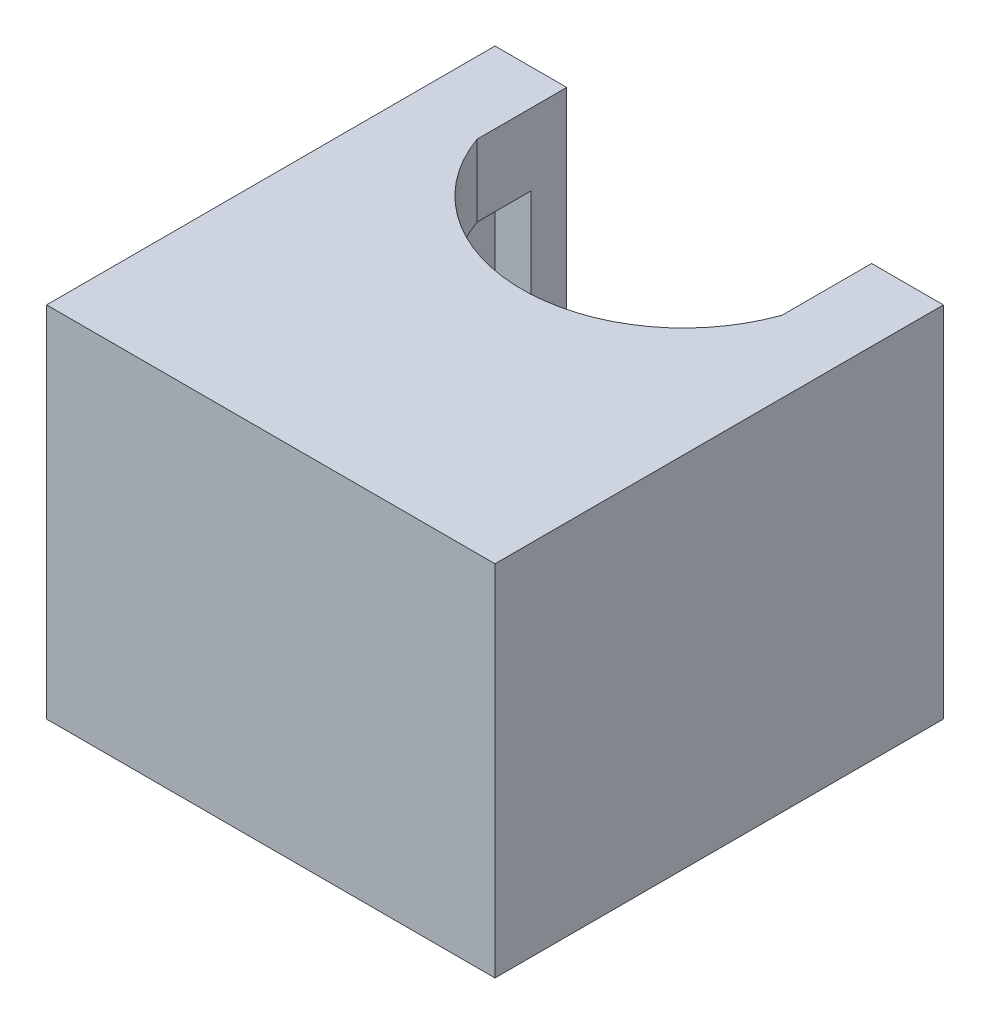
from build123d import *

# Parameters (mm, degrees)
ESQUISSE1_W             = 25
ESQUISSE1_H             = 20
BOSS_EXTRU_1_DEPTH      = 25
ESQUISSE2_W             = 21
ESQUISSE2_H             = 21
ENL_V_MAT_EXTRU_1_DEPTH = 16
ENL_V_MAT_EXTRU_2_DEPTH = 26
ESQUISSE13_W            = 43.843247266
ESQUISSE13_H            = 47.762498943
ENL_V_MAT_EXTRU_3_DEPTH = 20


with BuildPart() as part:
    # Esquisse1 → Boss.-Extru.1 (new body)
    with BuildSketch(Plane.XY):
        Rectangle(ESQUISSE1_W, ESQUISSE1_H)
    extrude(amount=BOSS_EXTRU_1_DEPTH)

    # Esquisse2 → Enlèv. mat.-Extru.1 (cut)
    with BuildSketch(Plane(origin=(0, -10, 0), x_dir=(-1, 0, 0), z_dir=(0, -1, 0))):
        with Locations((0, -12.5)):
            Rectangle(ESQUISSE2_W, ESQUISSE2_H)
    extrude(amount=-ENL_V_MAT_EXTRU_1_DEPTH, mode=Mode.SUBTRACT)

    # Esquisse3 → Enlèv. mat.-Extru.2 (cut)
    with BuildSketch(Plane(origin=(0, 10, 0), x_dir=(1, 0, 0), z_dir=(0, 1, 0))):
        with BuildLine():
            Line((8.5, 0), (-8.5, 0))
            Line((-8.5, 0), (-8.5, -5))
            ThreePointArc((-8.5, -5), (0, -11), (8.5, -5))
            Line((8.5, -5), (8.5, 0))
        make_face()
    extrude(amount=-ENL_V_MAT_EXTRU_2_DEPTH, mode=Mode.SUBTRACT)

    # Esquisse13 → Enlèv. mat.-Extru.3 (cut)
    with BuildSketch(Plane.XY):
        with Locations((-0.014308216, 12.074159602)):
            Rectangle(ESQUISSE13_W, ESQUISSE13_H)
    extrude(amount=-ENL_V_MAT_EXTRU_3_DEPTH, mode=Mode.SUBTRACT)


solid = part.part
